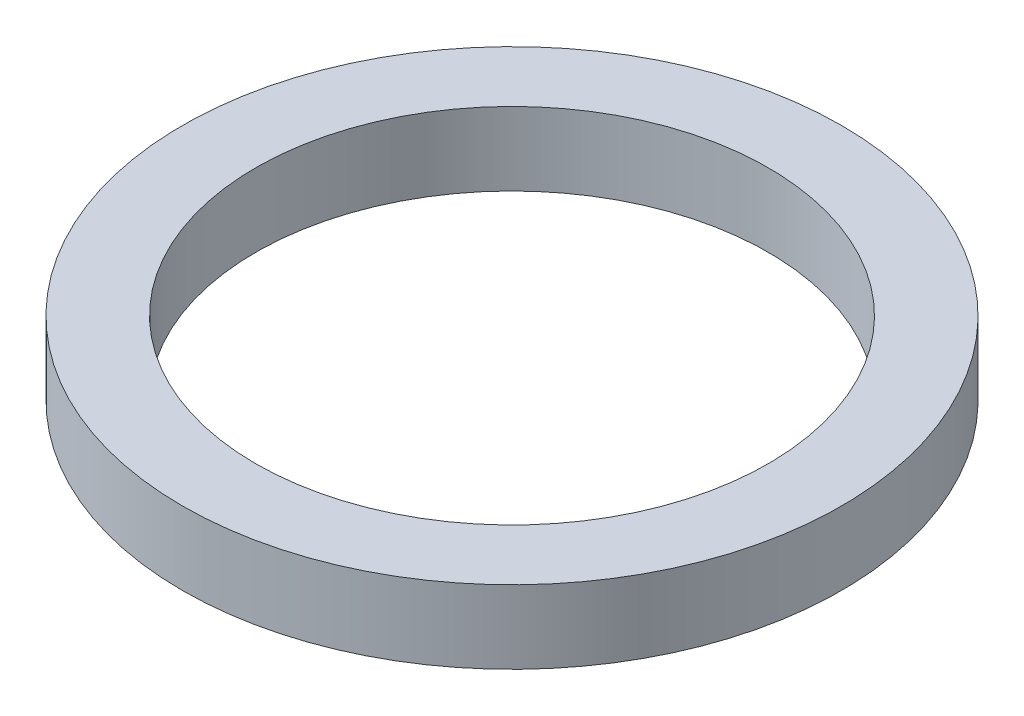
from build123d import *

# Parameters (mm, degrees)
SKETCH1_R           = 45
BOSS_EXTRUDE1_DEPTH = 10
SKETCH2_R           = 35
CUT_EXTRUDE1_DEPTH  = 65.420493634


with BuildPart() as part:
    # Sketch1 → Boss-Extrude1 (new body)
    with BuildSketch(Plane(origin=(0, 0, 0), x_dir=(1, 0, 0), z_dir=(0, 1, 0))):
        Circle(SKETCH1_R)
    extrude(amount=BOSS_EXTRUDE1_DEPTH)

    # Sketch2 → Cut-Extrude1 (cut, through all)
    with BuildSketch(Plane(origin=(0, 0, 0), x_dir=(1, 0, 0), z_dir=(0, 1, 0))):
        Circle(SKETCH2_R)
    extrude(amount=CUT_EXTRUDE1_DEPTH, mode=Mode.SUBTRACT)


solid = part.part
